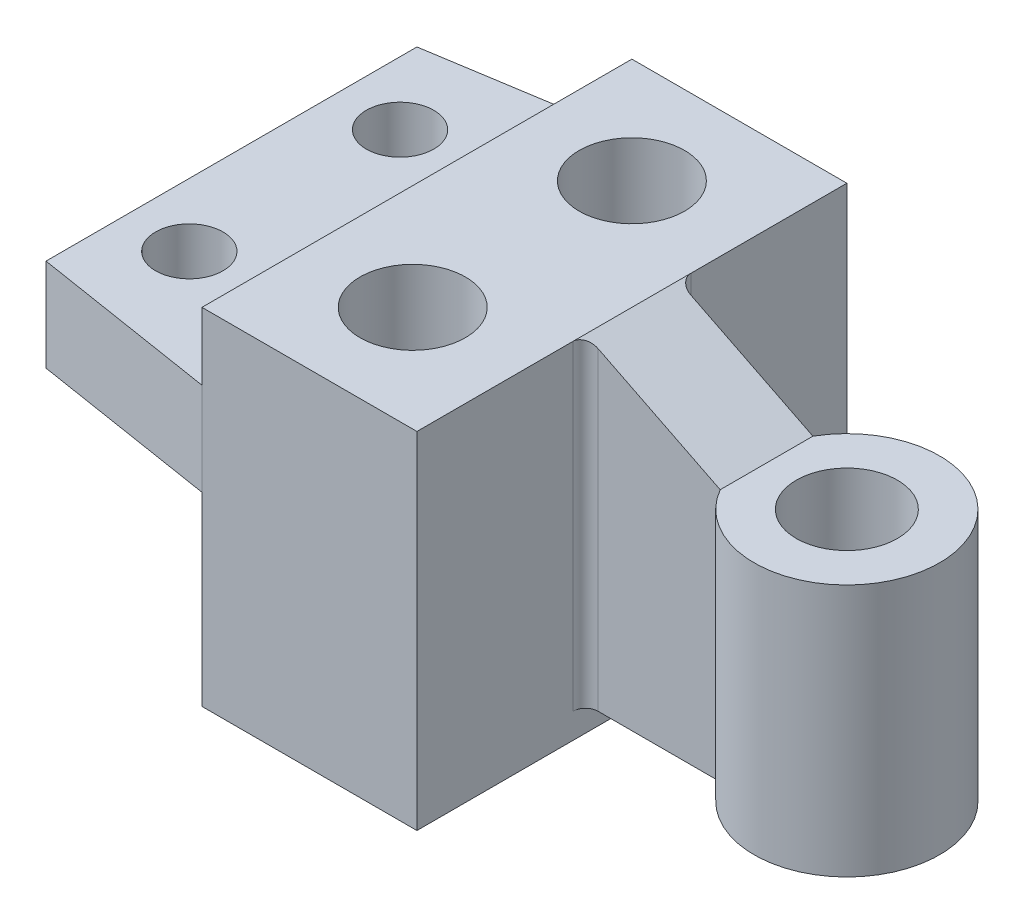
from build123d import *

# Parameters (mm, degrees)
SCHIZZO1_R                   = 22
SCHIZZO1_W                   = 51
SCHIZZO1_H                   = 102
SCHIZZO1_W_2                 = 31.947441117
SCHIZZO1_H_2                 = 22
ESTRUSIONE_ESTRUSIONE2_DEPTH = 82
SCHIZZO2_W                   = 80.086203662
SCHIZZO2_H                   = 68.356722048
TAGLIO_ESTRUSIONE1_DEPTH     = 6
SCHIZZO3_W                   = 81.899638904
SCHIZZO3_H                   = 77.244744974
TAGLIO_ESTRUSIONE4_DEPTH     = 16
ESTRUSIONE_ESTRUSIONE3_DEPTH = 22
SCHIZZO6_W                   = 102
SCHIZZO6_H                   = 22
ESTRUSIONE_ESTRUSIONE4_DEPTH = 44
SCHIZZO7_R                   = 8
TAGLIO_ESTRUSIONE5_DEPTH     = 130.452694062
SCHIZZO8_R                   = 12.5
TAGLIO_ESTRUSIONE6_DEPTH     = 139.29678232
SCHIZZO9_R                   = 12
TAGLIO_ESTRUSIONE7_DEPTH     = 130.452694062
RACCORDO1_R                  = 3
RACCORDO2_R                  = 3


with BuildPart() as part:
    # Schizzo1 → Estrusione-Estrusione2 (new body)
    with BuildSketch(Plane(origin=(0, 0, 0), x_dir=(1, 0, 0), z_dir=(0, 1, 0))):
        with Locations((77, 0)):
            Circle(SCHIZZO1_R)
        with Locations((0.5, 0)):
            Rectangle(SCHIZZO1_W, SCHIZZO1_H)
        with Locations((41.973720559, 0)):
            Rectangle(SCHIZZO1_W_2, SCHIZZO1_H_2)
    extrude(amount=ESTRUSIONE_ESTRUSIONE2_DEPTH)

    # Schizzo2 → Taglio-Estrusione1 (cut)
    with BuildSketch(Plane.XZ):
        with Locations((66.043101831, -4.044394055)):
            Rectangle(SCHIZZO2_W, SCHIZZO2_H)
    extrude(amount=-TAGLIO_ESTRUSIONE1_DEPTH, mode=Mode.SUBTRACT)

    # Schizzo3 → Taglio-Estrusione4 (cut)
    with BuildSketch(Plane(origin=(0, 82, 0), x_dir=(1, 0, 0), z_dir=(0, 1, 0))):
        with Locations((66.949819452, -1.56539862)):
            Rectangle(SCHIZZO3_W, SCHIZZO3_H)
    extrude(amount=-TAGLIO_ESTRUSIONE4_DEPTH, mode=Mode.SUBTRACT)

    # Schizzo5 → Estrusione-Estrusione3 (add)
    with BuildSketch(Plane.XY.offset(11)):
        Polygon((57.947441117, 66), (26, 82), (26, 66), align=None)
    extrude(amount=-ESTRUSIONE_ESTRUSIONE3_DEPTH)

    # Schizzo6 → Estrusione-Estrusione4 (add)
    with BuildSketch(Plane.ZY.offset(25)):
        with Locations((0, 55)):
            Rectangle(SCHIZZO6_W, SCHIZZO6_H)
    extrude(amount=ESTRUSIONE_ESTRUSIONE4_DEPTH)

    # Schizzo7 → Taglio-Estrusione5 (cut, through all)
    with BuildSketch(Plane(origin=(0, 66, 0), x_dir=(1, 0, 0), z_dir=(0, 1, 0))):
        with Locations(Location((-54, -25, 0), (0, 0, 270))):
            Circle(SCHIZZO7_R)
        with Locations(Location((-54, 25, 0), (0, 0, 270))):
            Circle(SCHIZZO7_R)
        Polygon((-25, -51), (-69, -44), (-69, -51), align=None)
        Polygon((-25, 51), (-69, 44), (-69, 51), align=None)
    extrude(amount=-TAGLIO_ESTRUSIONE5_DEPTH, mode=Mode.SUBTRACT)

    # Schizzo8 → Taglio-Estrusione6 (cut, through all)
    with BuildSketch(Plane(origin=(0, 82, 0), x_dir=(1, 0, 0), z_dir=(0, 1, 0))):
        with Locations(Location((0, -26, 0), (0, 0, 270))):
            Circle(SCHIZZO8_R)
        with Locations(Location((0, 26, 0), (0, 0, 270))):
            Circle(SCHIZZO8_R)
    extrude(amount=-TAGLIO_ESTRUSIONE6_DEPTH, mode=Mode.SUBTRACT)

    # Schizzo9 → Taglio-Estrusione7 (cut, through all)
    with BuildSketch(Plane(origin=(0, 66, 0), x_dir=(1, 0, 0), z_dir=(0, 1, 0))):
        with Locations(Location((77, 0, 0), (0, 0, 270))):
            Circle(SCHIZZO9_R)
    extrude(amount=-TAGLIO_ESTRUSIONE7_DEPTH, mode=Mode.SUBTRACT)

    # Raccordo1
    raccordo1_edges = [part.edges().sort_by_distance(p)[0] for p in [
        (26, 44, -11),
    ]]
    fillet(raccordo1_edges, radius=RACCORDO1_R)

    # Raccordo2
    # the kernel refuses this fillet: 3 mm, written as the material it adds along each edge
    with BuildSketch(Plane(origin=(26, 82, 11), x_dir=(1, 0, 0), z_dir=(0, -1, 0))) as raccordo2_piece_1_section:
        with BuildLine():
            CenterArc((RACCORDO2_R, RACCORDO2_R), RACCORDO2_R, 180, 90)
            Line((0, RACCORDO2_R), (0, 0))
            Line((0, 0), (RACCORDO2_R, 0))
        make_face()
    raccordo2_piece_1 = extrude(amount=76, mode=Mode.PRIVATE)
    raccordo2_piece_1 = split(raccordo2_piece_1, bisect_by=Plane(origin=(41.823834569, 74.075066289, 11.680808527), z_dir=(-0.44780189792218816, -0.8941327978646608, 0)), keep=Keep.TOP, mode=Mode.PRIVATE)
    add(raccordo2_piece_1)


solid = part.part
